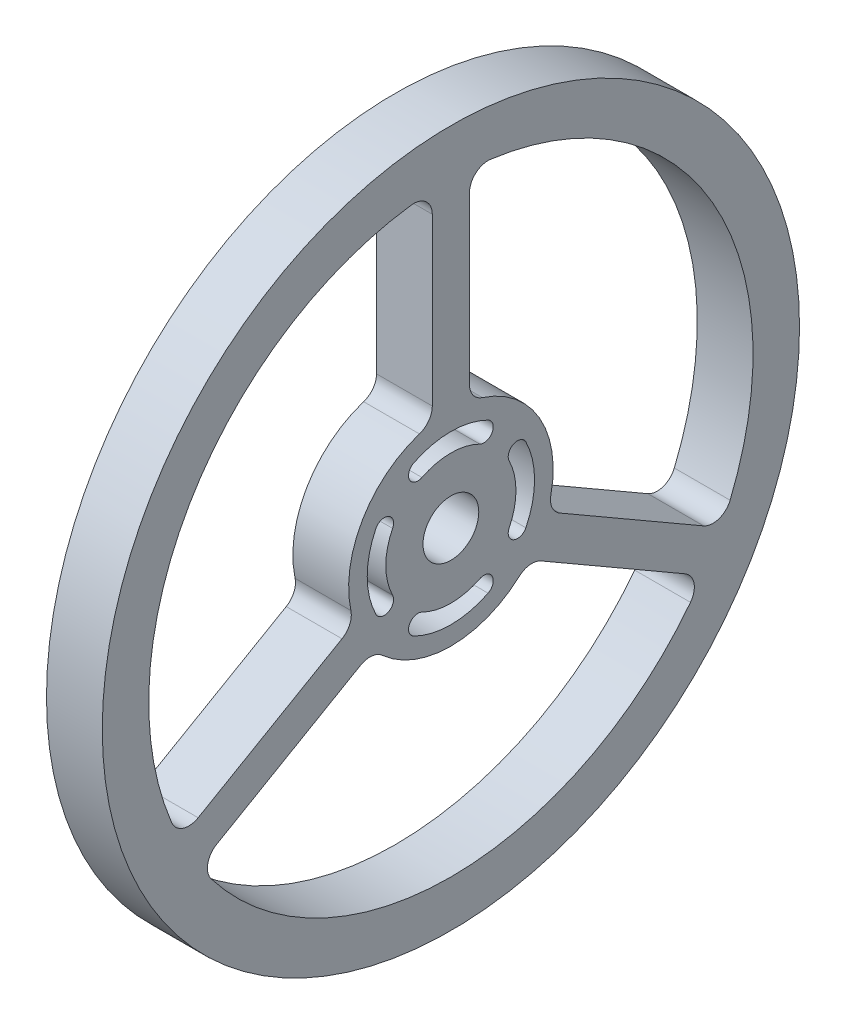
from build123d import *

# Parameters (mm, degrees)
SKETCH1_R           = 37.5
SKETCH1_R_2         = 3
BOSS_EXTRUDE1_DEPTH = 6
FILLET1_R           = 2
CUT_EXTRUDE1_DEPTH  = 10
CIRPATTERN1_COUNT   = 4


with BuildPart() as part:
    # Sketch1 → Boss-Extrude1 (new body)
    with BuildSketch(Plane(origin=(0, 0, 0), x_dir=(0, 0, -1), z_dir=(1, 0, 0))):
        Circle(SKETCH1_R)
        with BuildLine():
            Line((2, 10.816653826), (2, 32.438403167))
            ThreePointArc((2, 32.438403167), (28.145825623, 16.25), (29.0924812, -14.487150776))
            Line((29.0924812, -14.487150776), (10.367496998, -3.676276106))
            ThreePointArc((10.367496998, -3.676276106), (9.526279442, 5.5), (2, 10.816653826))
        make_face(mode=Mode.SUBTRACT)
        with BuildLine():
            ThreePointArc((-8.367496998, -7.140377721), (0, -11), (8.367496998, -7.140377721))
            Line((8.367496998, -7.140377721), (27.0924812, -17.951252391))
            ThreePointArc((27.0924812, -17.951252391), (0, -32.5), (-27.0924812, -17.951252391))
            Line((-27.0924812, -17.951252391), (-8.367496998, -7.140377721))
        make_face(mode=Mode.SUBTRACT)
        with BuildLine():
            ThreePointArc((-2, 10.816653826), (-9.526279442, 5.5), (-10.367496998, -3.676276106))
            Line((-10.367496998, -3.676276106), (-29.0924812, -14.487150776))
            ThreePointArc((-29.0924812, -14.487150776), (-28.145825623, 16.25), (-2, 32.438403167))
            Line((-2, 32.438403167), (-2, 10.816653826))
        make_face(mode=Mode.SUBTRACT)
        Circle(SKETCH1_R_2, mode=Mode.SUBTRACT)
    extrude(amount=BOSS_EXTRUDE1_DEPTH)

    # Fillet1
    fillet1_edges = [part.edges().sort_by_distance(p)[0] for p in [
        (3, -3.676276106, 10.367496998),
        (3, -7.140377721, 8.367496998),
        (3, -7.140377721, -8.367496998),
        (3, -3.676276106, -10.367496998),
        (3, 10.816653826, -2),
        (3, -17.951252391, -27.0924812),
        (3, -14.487150776, -29.0924812),
        (3, -17.951252391, 27.0924812),
        (3, -14.487150776, 29.0924812),
        (3, 32.438403167, -2),
        (3, 32.438403167, 2),
        (3, 10.816653826, 2),
    ]]
    fillet(fillet1_edges, radius=FILLET1_R)

    # Sketch2 → Cut-Extrude1 (cut)
    with BuildSketch(Plane(origin=(6, 0, 0), x_dir=(0, 0, -1), z_dir=(1, 0, 0))):
        with BuildLine():
            ThreePointArc((4, 8.062257748), (0, 9), (-4, 8.062257748))
            ThreePointArc((-4, 8.062257748), (-4.451361972, 6.722006887), (-3.111111111, 6.270644915))
            ThreePointArc((-3.111111111, 6.270644915), (0, 7), (3.111111111, 6.270644915))
            ThreePointArc((3.111111111, 6.270644915), (4.451361972, 6.722006887), (4, 8.062257748))
        make_face()
    cut_extrude1 = extrude(amount=-CUT_EXTRUDE1_DEPTH, mode=Mode.SUBTRACT)

    # CirPattern1: Cut-Extrude1 ×4 about axis
    cirpattern1_axis = Axis((6, 0, 0), (1, 0, 0))
    for i in range(1, CIRPATTERN1_COUNT):
        add(cut_extrude1.rotate(cirpattern1_axis, i * 360 / CIRPATTERN1_COUNT), mode=Mode.SUBTRACT)


solid = part.part
